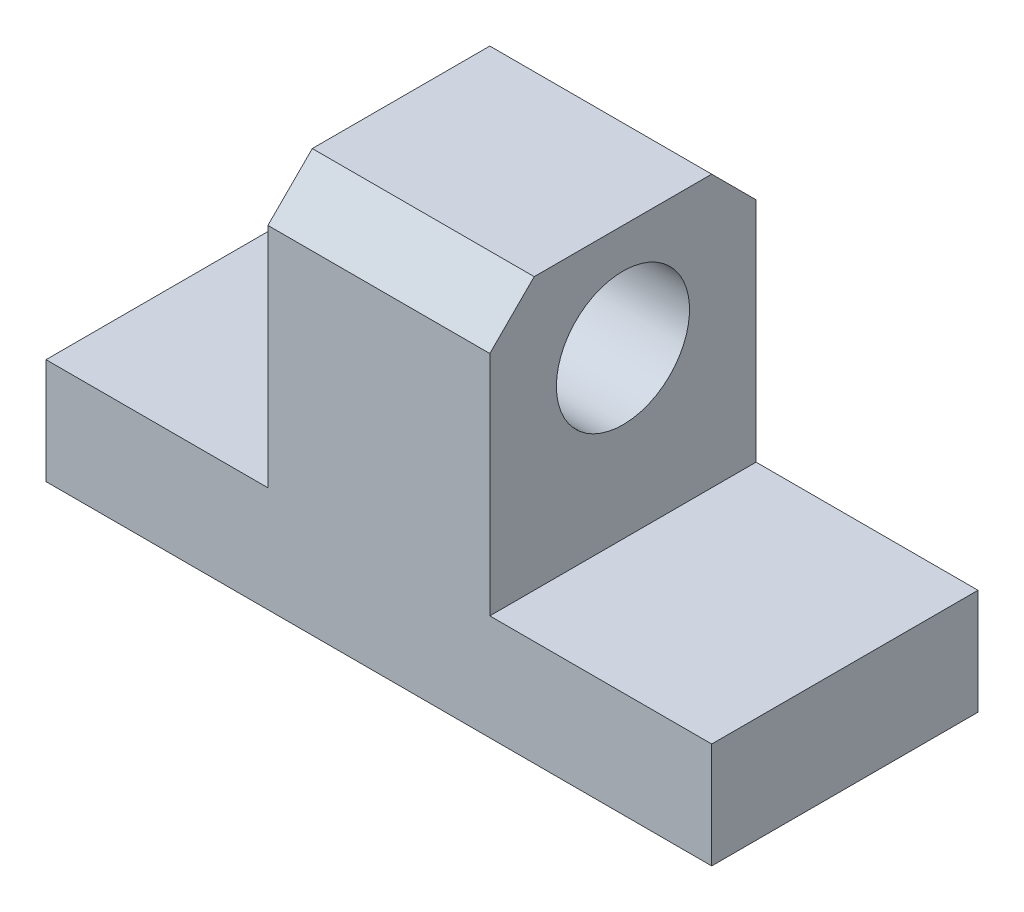
from build123d import *

# Parameters (mm, degrees)
EXTRUDE_2_DEPTH     = 12
CHAMFER_1_SIZE      = 2
SKETCH_4_R          = 3
CUT_EXTRUDE_4_DEPTH = 29.861739379


with BuildPart() as part:
    # Эскиз2 → Вытянуть2 (new body)
    with BuildSketch(Plane.XY):
        Polygon((0.846446281, 0), (-29.153553719, 0), (-29.153553719, 4.760108812), (-19.153553719, 4.760108812), (-19.153553719, 17), (-9.153553719, 17), (-9.153553719, 4.760108812), (0.846446281, 4.760108812), align=None)
    extrude(amount=EXTRUDE_2_DEPTH)

    # Фаска1
    chamfer_1_edges = [part.edges().sort_by_distance(p)[0] for p in [
        (-14.153553719, 17, 0),
        (-14.153553719, 17, 12),
    ]]
    chamfer(chamfer_1_edges, length=CHAMFER_1_SIZE)

    # Эскиз4 → Вытянуть4 (cut, through all)
    with BuildSketch(Plane.ZY.offset(19.153553719)):
        with Locations((6, 12.217021039)):
            Circle(SKETCH_4_R)
    extrude(amount=-CUT_EXTRUDE_4_DEPTH, mode=Mode.SUBTRACT)


solid = part.part
